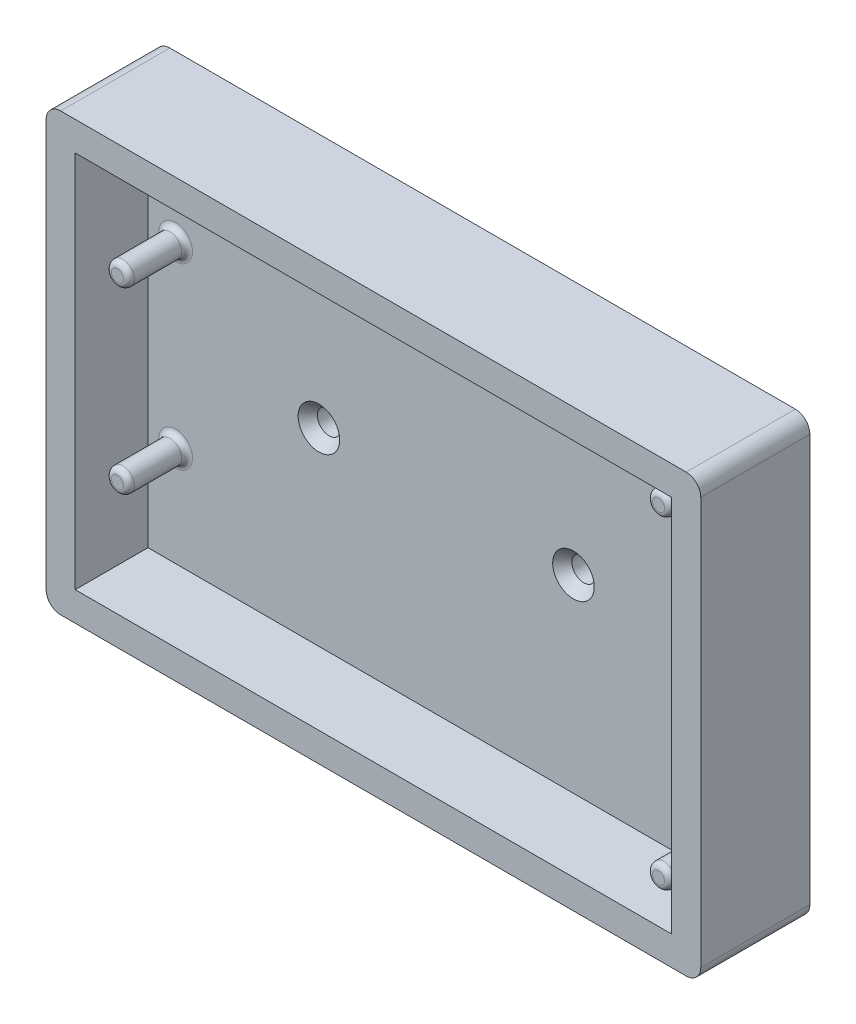
from build123d import *

# Parameters (mm, degrees)
ESQUISSE1_W                                       = 90
ESQUISSE1_H                                       = 60
BOSS_EXTRU_1_DEPTH                                = 5
ESQUISSE2_W                                       = 90
ESQUISSE2_H                                       = 60
ESQUISSE2_W_2                                     = 82
ESQUISSE2_H_2                                     = 52
BOSS_EXTRU_2_DEPTH                                = 10
ESQUISSE3_R                                       = 1.575
BOSS_EXTRU_3_DEPTH                                = 8
FRAISAGE_POUR_VIS_T_TE_FRAIS_E_BOMB_E_D           = 3.2639
FRAISAGE_POUR_VIS_T_TE_FRAIS_E_BOMB_E_CSINK_D     = 5.715
FRAISAGE_POUR_VIS_T_TE_FRAIS_E_BOMB_E_CSINK_ANGLE = 82
CONG_1_R                                          = 2
CONG_2_R                                          = 0.75


with BuildPart() as part:
    # Esquisse1 → Boss.-Extru.1 (new body)
    with BuildSketch(Plane.XY):
        Rectangle(ESQUISSE1_W, ESQUISSE1_H)
    extrude(amount=BOSS_EXTRU_1_DEPTH)

    # Esquisse2 → Boss.-Extru.2 (add)
    with BuildSketch(Plane.XY.offset(5)):
        Rectangle(ESQUISSE2_W, ESQUISSE2_H)
        Rectangle(ESQUISSE2_W_2, ESQUISSE2_H_2, mode=Mode.SUBTRACT)
    extrude(amount=BOSS_EXTRU_2_DEPTH)

    # Esquisse3 → Boss.-Extru.3 (add)
    with BuildSketch(Plane.XY.offset(5)):
        with Locations((-37.2, 12.3)):
            Circle(ESQUISSE3_R)
        with Locations((-37.2, -12.3)):
            Circle(ESQUISSE3_R)
        with Locations((37.2, -22.2)):
            Circle(ESQUISSE3_R)
        with Locations((37.2, 22.2)):
            Circle(ESQUISSE3_R)
    extrude(amount=BOSS_EXTRU_3_DEPTH)

    # Fraisage pour vis à tête fraisée bombée #41 (through all)
    with Locations(Plane.XY.offset(5)):
        with Locations((-17.5, 0), (17.5, 0)):
            CounterSinkHole(FRAISAGE_POUR_VIS_T_TE_FRAIS_E_BOMB_E_D / 2, FRAISAGE_POUR_VIS_T_TE_FRAIS_E_BOMB_E_CSINK_D / 2, counter_sink_angle=FRAISAGE_POUR_VIS_T_TE_FRAIS_E_BOMB_E_CSINK_ANGLE)

    # Congé1
    cong_1_edges = [part.edges().sort_by_distance(p)[0] for p in [
        (-45, -30, 7.5),
        (-45, 30, 7.5),
        (45, 30, 7.5),
        (45, -30, 7.5),
    ]]
    fillet(cong_1_edges, radius=CONG_1_R)

    # Congé2
    cong_2_edges = [part.edges().sort_by_distance(p)[0] for p in [
        (35.625, 22.2, 13),
        (-38.775, 12.3, 13),
        (35.625, 22.2, 5),
        (-38.775, 12.3, 5),
        (-38.775, -12.3, 5),
        (35.625, -22.2, 5),
        (-38.775, -12.3, 13),
        (35.625, -22.2, 13),
    ]]
    fillet(cong_2_edges, radius=CONG_2_R)


solid = part.part
